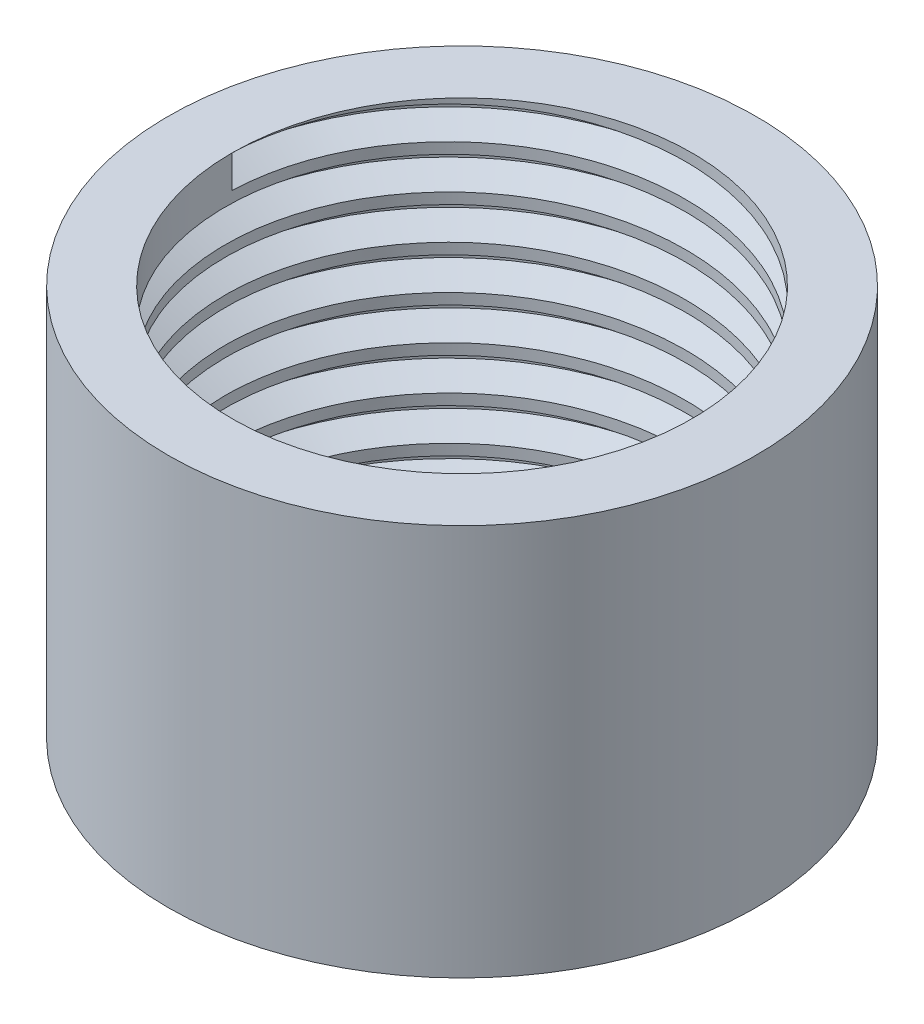
from build123d import *

# Parameters (mm, degrees)
SKETCH1_R           = 9.525
SKETCH1_R_2         = 7.46125
BOSS_EXTRUDE1_DEPTH = 12.7
THREAD1_PITCH       = 1.411111111


with BuildPart() as part:
    # Sketch1 → Boss-Extrude1 (new body)
    with BuildSketch(Plane(origin=(0, 0, 0), x_dir=(1, 0, 0), z_dir=(0, 1, 0))):
        with Locations(Location((0, 0, 0), (0, 0, 270))):
            Circle(SKETCH1_R)
        with Locations(Location((0, 0, 0), (0, 0, 270))):
            Circle(SKETCH1_R_2, mode=Mode.SUBTRACT)
    extrude(amount=BOSS_EXTRUDE1_DEPTH)

    # Thread1: the profile of Thread Profile1 profile screwed along a right-hand helix of 9 turns, 8 arcs to a turn; built about Z, then put on its axis
    thread1_z = Axis((0, 0, 0), (0, 0, 1))
    thread1_corners = [(7.46095, 0, -0.000173205), (8.22503629, 0, 0.44097222), (8.22503629, 0, 0.617361109), (7.46095, 0, 1.058506535)]
    with BuildLine(mode=Mode.PRIVATE) as thread1_profile:
        Line(thread1_corners[0], thread1_corners[1])
        Line(thread1_corners[1], thread1_corners[2])
        Line(thread1_corners[2], thread1_corners[3])
        Line(thread1_corners[3], thread1_corners[0])
    thread1_cap = Face(thread1_profile.wire())
    thread1_turn_angles = [0, 22.5, 45, 67.5, 90, 112.5, 135, 157.5, 180, 202.5, 225, 247.5, 270, 292.5, 315, 337.5, 360]
    thread1_turn_weights = [1, 0.9238795325112867, 1, 0.9238795325112867, 1, 0.9238795325112867, 1, 0.9238795325112867, 1, 0.9238795325112867, 1, 0.9238795325112867, 1, 0.9238795325112867, 1, 0.9238795325112867, 1]
    thread1_turn_rails = [Edge.make_bspline([Vector(p[0], p[1], 0).rotate(thread1_z, thread1_turn_angles[k]) / thread1_turn_weights[k] + Vector(0, 0, p[2] + THREAD1_PITCH * thread1_turn_angles[k] / 360) for k in range(17)], [0, 0, 0, 1, 1, 2, 2, 3, 3, 4, 4, 5, 5, 6, 6, 7, 7, 8, 8, 8], 2, thread1_turn_weights) for p in thread1_corners]
    thread1_turn_sides = [Face.make_surface_from_curves(thread1_turn_rails[p[0]], thread1_turn_rails[p[1]]) for p in [(0, 1), (1, 2), (2, 3), (3, 0)]]
    thread1 = Plane(origin=(0, 12.7, 0), x_dir=(-1, 0, 0), z_dir=(0, -1, 0)) * Solid(Shell([*[p.moved(Location((0, 0, THREAD1_PITCH * i))) for i in range(9) for p in thread1_turn_sides], thread1_cap, thread1_cap.rotate(thread1_z, 3240).moved(Location((0, 0, THREAD1_PITCH * 3240 / 360)))]))
    add(thread1, mode=Mode.SUBTRACT)


solid = part.part
